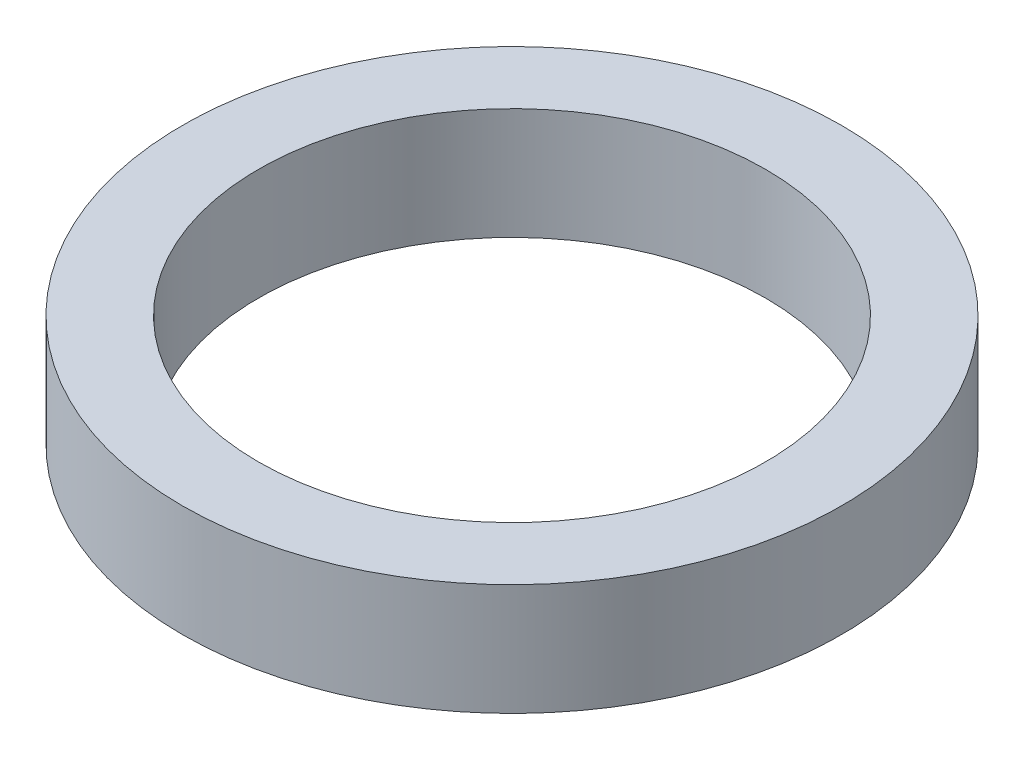
from build123d import *

# Parameters (mm, degrees)
SKETCH1_R           = 65
BOSS_EXTRUDE1_DEPTH = 22
SKETCH2_R           = 50
CUT_EXTRUDE1_DEPTH  = 95.519839187


with BuildPart() as part:
    # Sketch1 → Boss-Extrude1 (new body)
    with BuildSketch(Plane(origin=(0, 0, 0), x_dir=(1, 0, 0), z_dir=(0, 1, 0))):
        Circle(SKETCH1_R)
    extrude(amount=BOSS_EXTRUDE1_DEPTH)

    # Sketch2 → Cut-Extrude1 (cut, through all)
    with BuildSketch(Plane(origin=(0, 0, 0), x_dir=(1, 0, 0), z_dir=(0, 1, 0))):
        Circle(SKETCH2_R)
    extrude(amount=CUT_EXTRUDE1_DEPTH, mode=Mode.SUBTRACT)


solid = part.part
